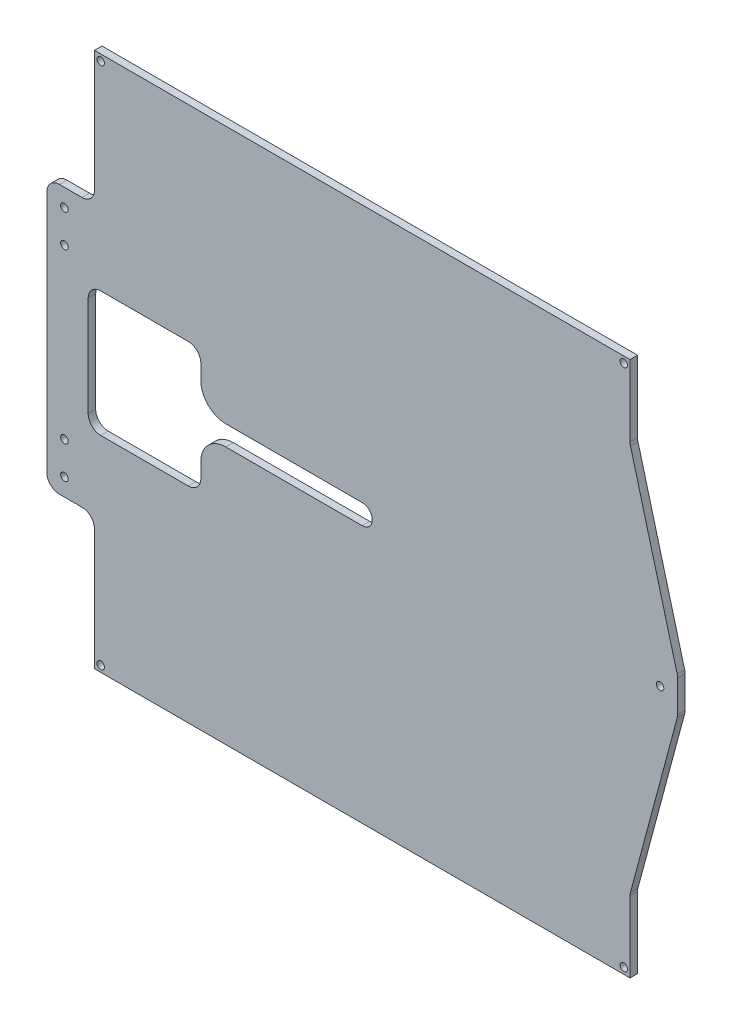
from build123d import *

# Parameters (mm, degrees)
BOSS_EXTRUDE1_OUTLINE_R = 1.5
BOSS_EXTRUDE1_DEPTH     = 3
SKETCH1_R               = 1.5
CUT_EXTRUDE1_DEPTH      = 10
CIRPATTERN1_COUNT       = 4
SKETCH3_W               = 736.909485963
SKETCH3_H               = 680.360125743
CUT_EXTRUDE2_DEPTH      = 304.313928241
FILLET2_R               = 5
FILLET3_R               = 5
SKETCH4_R               = 1.5
CUT_EXTRUDE3_DEPTH      = 10


# Read off the part's stored shape, not the designer's step: Boss-Extrude1
with BuildPart() as part:
    # Boss-Extrude1 outline → Boss-Extrude1 (new body)
    with BuildSketch(Plane.XY):
        with BuildLine():
            ThreePointArc((227.170370868, 138.011217036), (227.042775693, 138.652681301), (227, 139.305312262))
            Line((227, 139.305312262), (227, 176.497490519))
            ThreePointArc((227, 176.497490519), (225.535533906, 180.033024425), (222, 181.497490519))
            Line((222, 181.497490519), (12.343347406, 181.497486855))
            ThreePointArc((12.343347406, 181.497486855), (8.909508183, 179.979649569), (7.5, 176.499941461))
            Line((7.5, 176.499941461), (7.5, 130.6))
            ThreePointArc((7.5, 130.6), (6.035533906, 127.064466094), (2.5, 125.6))
            Line((2.5, 125.6), (-4, 125.6))
            ThreePointArc((-4, 125.6), (-7.535533906, 124.135533906), (-9, 120.6))
            Line((-9, 120.6), (-9, 23.4))
            ThreePointArc((-9, 23.4), (-7.535533906, 19.864466094), (-4, 18.4))
            Line((-4, 18.4), (2.5, 18.4))
            ThreePointArc((2.5, 18.4), (6.035533906, 16.935533906), (7.5, 13.4))
            Line((7.5, 13.4), (7.5, -32.5))
            ThreePointArc((7.5, -32.5), (8.964466094, -36.035533906), (12.5, -37.5))
            Line((12.5, -37.5), (221.5, -37.5))
            ThreePointArc((221.5, -37.5), (225.035533906, -36.035533906), (226.5, -32.5))
            Line((226.5, -32.5), (226.5, 2.762899187))
            ThreePointArc((226.5, 2.762899187), (226.542775693, 3.415530148), (226.670370869, 4.056994413))
            Line((226.670370869, 4.056994413), (242.829629131, 64.364167262))
            ThreePointArc((242.829629131, 64.364167262), (242.957224307, 65.005631527), (243, 65.658262488))
            Line((243, 65.658262488), (243, 78.275974364))
            ThreePointArc((243, 78.275974364), (242.957224307, 78.928605325), (242.829629131, 79.570069589))
            Line((242.829629131, 79.570069589), (227.170370868, 138.011217036))
        make_face()
        with Locations((-2, 25.4)):
            Circle(BOSS_EXTRUDE1_OUTLINE_R, mode=Mode.SUBTRACT)
        with Locations((-2, 118.6)):
            Circle(BOSS_EXTRUDE1_OUTLINE_R, mode=Mode.SUBTRACT)
        with BuildLine():
            ThreePointArc((62.5, 68), (55.428932188, 65.071067812), (52.5, 58))
            Line((52.5, 58), (52.5, 52))
            ThreePointArc((52.5, 52), (51.035533906, 48.464466094), (47.5, 47))
            Line((47.5, 47), (12.5, 47))
            ThreePointArc((12.5, 47), (8.964466094, 48.464466094), (7.5, 52))
            Line((7.5, 52), (7.5, 92))
            ThreePointArc((7.5, 92), (8.964466094, 95.535533906), (12.5, 97))
            Line((12.5, 97), (47.5, 97))
            ThreePointArc((47.5, 97), (51.035533906, 95.535533906), (52.5, 92))
            Line((52.5, 92), (52.5, 86))
            ThreePointArc((52.5, 86), (55.428932188, 78.928932188), (62.5, 76))
            Line((62.5, 76), (117, 76))
            ThreePointArc((117, 76), (121, 72), (117, 68))
            Line((117, 68), (62.5, 68))
        make_face(mode=Mode.SUBTRACT)
        with Locations((236, 72)):
            Circle(BOSS_EXTRUDE1_OUTLINE_R, mode=Mode.SUBTRACT)
    extrude(amount=BOSS_EXTRUDE1_DEPTH)

    # Sketch1 → Cut-Extrude1 (cut)
    with BuildSketch(Plane.XY.offset(3)):
        with Locations((221.5, -32.501254741)):
            Circle(SKETCH1_R)
    cut_extrude1 = extrude(amount=-CUT_EXTRUDE1_DEPTH, mode=Mode.SUBTRACT)

    # CirPattern1: Cut-Extrude1 ×4 about axis
    cirpattern1_axis = Axis((117, 72, 0), (0, 0, 1))
    for i in range(1, CIRPATTERN1_COUNT):
        add(cut_extrude1.rotate(cirpattern1_axis, i * 360 / CIRPATTERN1_COUNT), mode=Mode.SUBTRACT)

    # Sketch3 → Cut-Extrude2 (cut, through all)
    with BuildSketch(Plane.XY.offset(3)):
        with Locations((306.942195916, -80.480880195)):
            Rectangle(SKETCH3_W, SKETCH3_H)
        Polygon((-4, 18.4), (10.001254741, 18.4), (10.001254741, -35), (224.001254741, -35), (224.001254741, -5.904282588), (241.995428238, 61.250887144), (247.405063047, 62.49431775), (224.001254741, 149.838519439), (224.001254741, 179), (10.001254741, 179), (10.001254741, 125.6), (-4, 125.6), (-27.04848394, 125.6), (-22.601157645, 14.939042157), align=None, mode=Mode.SUBTRACT)
    extrude(amount=-CUT_EXTRUDE2_DEPTH, mode=Mode.SUBTRACT)

    # Fillet2
    fillet2_edges = [part.edges().sort_by_distance(p)[0] for p in [
        (10.001254741, 125.6, 1.5),
        (10.001254741, 18.4, 1.5),
    ]]
    fillet(fillet2_edges, radius=FILLET2_R)

    # Fillet3
    fillet3_edges = [part.edges().sort_by_distance(p)[0] for p in [
        (224.001254741, -5.904282588, 1.5),
        (224.001254741, 149.838519439, 1.5),
    ]]
    fillet(fillet3_edges, radius=FILLET3_R)

    # Sketch4 → Cut-Extrude3 (cut)
    with BuildSketch(Plane(origin=(0, 0, 0), x_dir=(-1, 0, 0), z_dir=(0, 0, -1))):
        with Locations((2, 105.6)):
            Circle(SKETCH4_R)
        with Locations((2, 38.4)):
            Circle(SKETCH4_R)
    extrude(amount=-CUT_EXTRUDE3_DEPTH, mode=Mode.SUBTRACT)


solid = part.part
